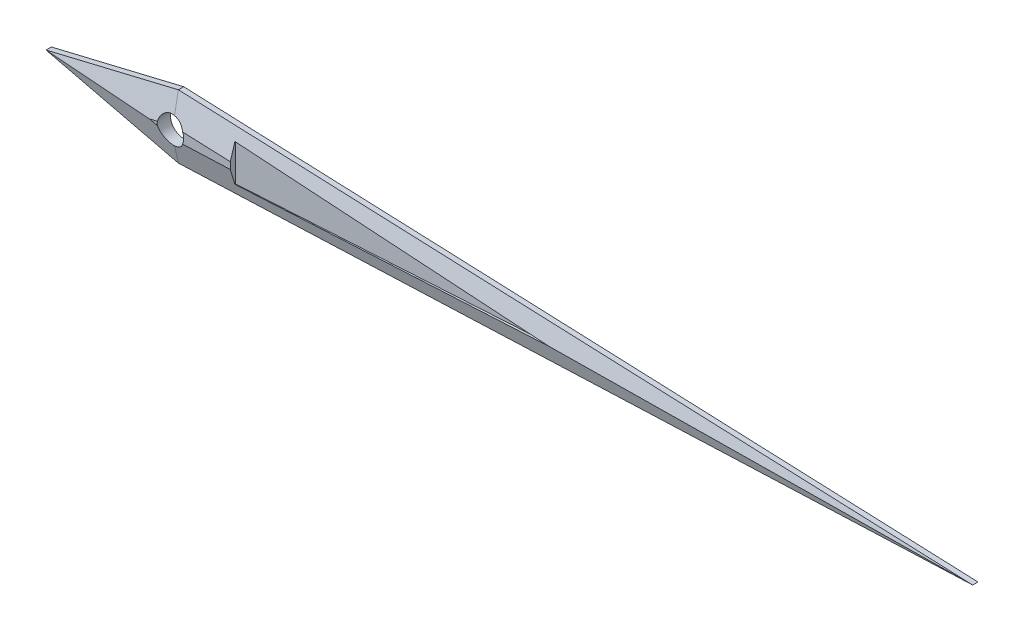
from build123d import *
from OCP.BRepFilletAPI import BRepFilletAPI_MakeChamfer

# Parameters (mm, degrees)
BOSS_EXTRUDE1_DEPTH = 0.25
SKETCH2_R           = 0.25
CUT_EXTRUDE1_DEPTH  = 0.25
CHAMFER2_SIZE       = 0.15
CHAMFER2_SIZE2      = 0.490627893
CUT_EXTRUDE2_DEPTH  = 0.1


with BuildPart() as part:
    # Sketch1 → Boss-Extrude1 (new body)
    with BuildSketch(Plane.XY):
        Polygon((0, 0.6), (-2.5, 0), (0, -0.6), (15, 0), align=None)
    extrude(amount=BOSS_EXTRUDE1_DEPTH)

    # Sketch2 → Cut-Extrude1 (cut)
    with BuildSketch(Plane.XY.offset(0.25)):
        Circle(SKETCH2_R)
    extrude(amount=-CUT_EXTRUDE1_DEPTH, mode=Mode.SUBTRACT)

    # Chamfer1
    # the kernel refuses this chamfer: 0.490627893, 0.15 mm, written as the material it takes off along each edge
    with BuildSketch(Plane(origin=(18.054124469, -0.122164979, 0.25), x_dir=(0.004781856159263962, 0.1195464039815991, -0.9928170985366542), z_dir=(-0.9992009587217895, 0.039968038348871575, 0))) as chamfer1_piece_1:
        with BuildLine():
            Line((0.156864571, 0), (-0.06664171, 0.505050061))
            Line((-0.06664171, 0.505050061), (-0.076383785, 0.503876067))
            ThreePointArc((-0.076383785, 0.503876067), (-0.040214623, 0.251694279), (-0.009742075, -0.001173994))
            Line((-0.009742075, -0.001173994), (0.001173994, -0.009742075))
            ThreePointArc((0.001173994, -0.009742075), (0.078483584, -0.000425682), (0.158038565, -0.009742075))
            Line((0.158038565, -0.009742075), (0.156864571, 0))
        make_face()
    extrude(amount=21.125128788, mode=Mode.SUBTRACT)
    with BuildSketch(Plane(origin=(-3.054124469, -0.722164979, 0.25), x_dir=(-0.039965503065755754, 0.999137576643894, 0.011263281176818171), z_dir=(0.9992009587217895, 0.039968038348871575, 0))) as chamfer1_piece_2:
        with BuildLine():
            Line((0.509427799, 0), (-0.02052052, -0.155516565))
            Line((-0.02052052, -0.155516565), (-0.030332455, -0.155406043))
            ThreePointArc((-0.030332455, -0.155406043), (-0.010688995, -0.077753453), (-0.009811935, 0.000110522))
            Line((-0.009811935, 0.000110522), (0.000110522, 0.009811935))
            ThreePointArc((0.000110522, 0.009811935), (0.254792108, 0.006943203), (0.50953832, 0.009811935))
            Line((0.50953832, 0.009811935), (0.509427799, 0))
        make_face()
    extrude(amount=21.125128788, mode=Mode.SUBTRACT)

    # Chamfer2: one chamfer whose edges measure the first distance from different faces: ONE call of the kernel's chamfer builder (chamfer() names one face for all edges)
    chamfer2_edges_1 = [part.edges().sort_by_distance(p)[0] for p in [
        (-2.126821854, 0.089562755, 0.25),
    ]]
    chamfer2_side_1 = [part.faces().sort_by_distance(p)[0] for p in [
        (-1.427358804, 0.257433887, 0.105010717),
    ]]
    chamfer2_edges_2 = [part.edges().sort_by_distance(p)[0] for p in [
        (-2.126821854, -0.089562755, 0.25),
    ]]
    chamfer2_side_2 = [part.faces().sort_by_distance(p)[0] for p in [
        (-1.427358804, -0.257433887, 0.105010717),
    ]]
    chamfer2 = BRepFilletAPI_MakeChamfer(part.part.solid().wrapped)
    for e in chamfer2_edges_1:
        chamfer2.Add(CHAMFER2_SIZE, CHAMFER2_SIZE2, e.wrapped, chamfer2_side_1[0].wrapped)  # the first distance lies on this face
    for e in chamfer2_edges_2:
        chamfer2.Add(CHAMFER2_SIZE, CHAMFER2_SIZE2, e.wrapped, chamfer2_side_2[0].wrapped)  # the first distance lies on this face
    add(Compound.cast(chamfer2.Shape()), mode=Mode.REPLACE)

    # Sketch3 → Cut-Extrude2 (cut)
    with BuildSketch(Plane.XY.offset(0.25)):
        Polygon((1.130057814, 0.35), (1.130057814, -0.35), (7.104536448, 0), align=None)
    extrude(amount=-CUT_EXTRUDE2_DEPTH, mode=Mode.SUBTRACT)


solid = part.part
